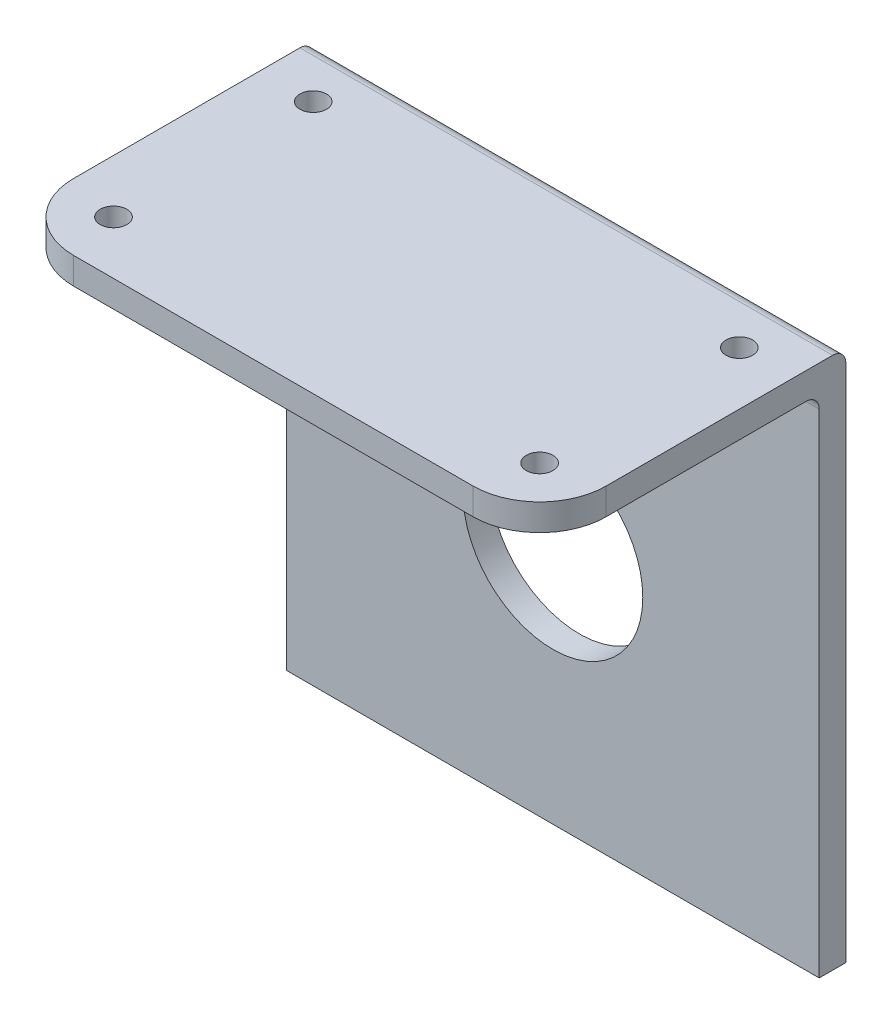
from build123d import *

# Parameters (mm, degrees)
SKETCH1_W           = 40
SKETCH1_H           = 40
SKETCH1_R           = 6.75
BOSS_EXTRUDE2_DEPTH = 2
SKETCH2_W           = 40
SKETCH2_H           = 2
BOSS_EXTRUDE3_DEPTH = 23
SKETCH3_R           = 1
CUT_EXTRUDE1_DEPTH  = 2
FILLET1_R           = 1
FILLET2_R           = 1
FILLET3_R           = 5


with BuildPart() as part:
    # Sketch1 → Boss-Extrude2 (new body)
    with BuildSketch(Plane.XY):
        Rectangle(SKETCH1_W, SKETCH1_H)
        with Locations((0, -1.878854291)):
            Circle(SKETCH1_R, mode=Mode.SUBTRACT)
    extrude(amount=BOSS_EXTRUDE2_DEPTH)

    # Sketch2 → Boss-Extrude3 (add)
    with BuildSketch(Plane.XY):
        with Locations((0, 19)):
            Rectangle(SKETCH2_W, SKETCH2_H)
    extrude(amount=BOSS_EXTRUDE3_DEPTH)

    # Sketch3 → Cut-Extrude1 (cut)
    with BuildSketch(Plane(origin=(0, 20, 0), x_dir=(1, 0, 0), z_dir=(0, 1, 0))):
        with Locations(Location((-16, -4, 0), (0, 0, 270))):
            Circle(SKETCH3_R)
        with Locations(Location((16, -4, 0), (0, 0, 270))):
            Circle(SKETCH3_R)
        with Locations(Location((16, -19, 0), (0, 0, 270))):
            Circle(SKETCH3_R)
        with Locations(Location((-16, -19, 0), (0, 0, 270))):
            Circle(SKETCH3_R)
    extrude(amount=-CUT_EXTRUDE1_DEPTH, mode=Mode.SUBTRACT)

    # Fillet1
    fillet1_edges = [part.edges().sort_by_distance(p)[0] for p in [
        (0, 20, 0),
    ]]
    fillet(fillet1_edges, radius=FILLET1_R)

    # Fillet2
    fillet2_edges = [part.edges().sort_by_distance(p)[0] for p in [
        (0, 18, 2),
    ]]
    fillet(fillet2_edges, radius=FILLET2_R - 0.0001)  # a hair under: the kernel refuses the full size

    # Fillet3
    fillet3_edges = [part.edges().sort_by_distance(p)[0] for p in [
        (-20, 19, 23),
        (20, 19, 23),
    ]]
    fillet(fillet3_edges, radius=FILLET3_R)


solid = part.part
